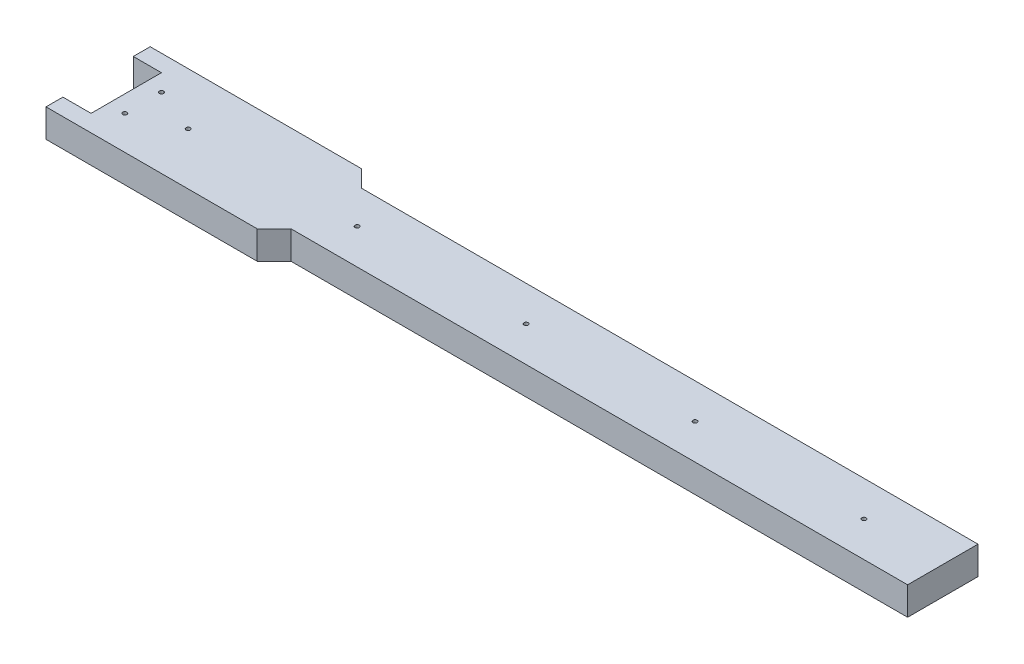
from build123d import *

# Parameters (mm, degrees)
EXTRUDE_1_DEPTH        = 10
SKETCH_2_R             = 0.75
CUT_EXTRUDE_1_DEPTH    = 302.763152157
PATTERN_LINEAR_1_COUNT = 5
PATTERN_LINEAR_1_PITCH = 60
SKETCH_4_R             = 0.75
CUT_EXTRUDE_2_DEPTH    = 302.763152157


with BuildPart() as part:
    # Эскиз1 → Бобышка-Вытянуть1 (new body)
    with BuildSketch(Plane(origin=(0, 0, 0), x_dir=(1, 0, 0), z_dir=(0, 1, 0))):
        Polygon((0, 31), (75, 31), (81, 25), (300, 25), (300, 0), (81, 0), (75, -6), (0, -6), (0, 0), (10, 0), (10, 25), (0, 25), align=None)
    extrude(amount=EXTRUDE_1_DEPTH)

    # Эскиз2 → Вырез-Вытянуть1 (cut, through all)
    with BuildSketch(Plane(origin=(0, 10, 0), x_dir=(1, 0, 0), z_dir=(0, 1, 0))):
        with Locations((32, 12.5)):
            Circle(SKETCH_2_R)
    cut_extrude_1 = extrude(amount=-CUT_EXTRUDE_1_DEPTH, mode=Mode.SUBTRACT)

    # Линейный массив1: Вырез-Вытянуть1 ×5
    with Locations(*[(i * PATTERN_LINEAR_1_PITCH, 0, 0) for i in range(1, PATTERN_LINEAR_1_COUNT)]):
        add(cut_extrude_1, mode=Mode.SUBTRACT)

    # Эскиз4 → Вырез-Вытянуть2 (cut, through all)
    with BuildSketch(Plane(origin=(0, 10, 0), x_dir=(1, 0, 0), z_dir=(0, 1, 0))):
        with Locations((16, 6)):
            Circle(SKETCH_4_R)
        with Locations((16, 19)):
            Circle(SKETCH_4_R)
    extrude(amount=-CUT_EXTRUDE_2_DEPTH, mode=Mode.SUBTRACT)


solid = part.part
